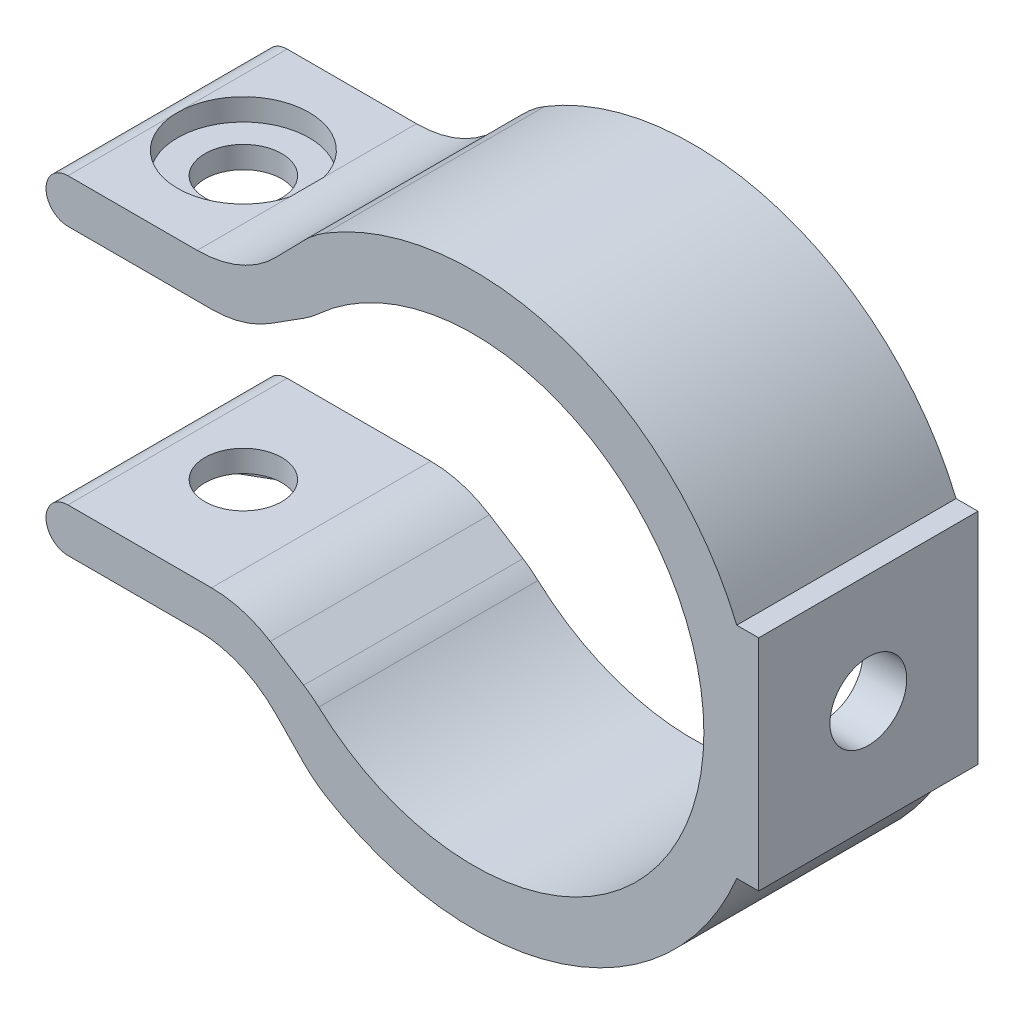
from build123d import *

# Parameters (mm, degrees)
EXTRUDE_1_DEPTH      = 5
EXTRUDE_1_DEPTH_BACK = 5
SKETCH_367_W         = 9
SKETCH_367_H         = 2
FILLET_1_R           = 5
FILLET_2_R           = 1
SKETCH_1_R           = 1.75
CUT_EXTRUDE_2_DEPTH  = 29.731515797
SKETCH_1_6_R         = 3
CUT_EXTRUDE_3_DEPTH  = 1
SKETCH_5_W           = 10
SKETCH_5_H           = 10
EXTRUDE_2_DEPTH      = 2
SKETCH_6_R           = 1.75
CUT_EXTRUDE_5_DEPTH  = 24.963513933
SKETCH_6_3_R         = 3
CUT_EXTRUDE_6_DEPTH  = 11
CUT_EXTRUDE_7_DEPTH  = 1


with BuildPart() as part:
    # Sketch 367 → Бобышка-Вытянуть1 (new, two sides: drawn at the far end of the back side and taken through both)
    with BuildSketch(Plane.XY.offset(-EXTRUDE_1_DEPTH_BACK)):
        with BuildLine():
            ThreePointArc((-7.348469228, 10.723805295), (13, 0), (-7.348469228, -10.723805295))
            Line((-7.348469228, -10.723805295), (-10.5, -7.5))
            Line((-10.5, -7.5), (-10.5, -5.5))
            Line((-10.5, -5.5), (-7.348469228, -7.5))
            ThreePointArc((-7.348469228, -7.5), (10.5, 0), (-7.348469228, 7.5))
            Line((-7.348469228, 7.5), (-10.5, 5.5))
            Line((-10.5, 5.5), (-10.5, 7.5))
            Line((-10.5, 7.5), (-7.348469228, 10.723805295))
        make_face()
        with Locations((-15, 6.5)):
            Rectangle(SKETCH_367_W, SKETCH_367_H)
        with Locations((-15, -6.5)):
            Rectangle(SKETCH_367_W, SKETCH_367_H)
    extrude(amount=EXTRUDE_1_DEPTH + EXTRUDE_1_DEPTH_BACK)

    # Скругление1
    fillet_1_edges = [part.edges().sort_by_distance(p)[0] for p in [
        (-7.348469228, -10.723805295, 0),
        (-10.5, -7.5, 0),
        (-10.5, -5.5, 0),
        (-7.348469228, -7.5, 0),
        (-7.348469228, 7.5, 0),
        (-10.5, 5.5, 0),
        (-10.5, 7.5, 0),
        (-7.348469228, 10.723805295, 0),
    ]]
    fillet(fillet_1_edges, radius=FILLET_1_R)

    # Скругление2
    fillet_2_edges = [part.edges().sort_by_distance(p)[0] for p in [
        (-19.5, -7.5, 0),
        (-19.5, -5.5, 0),
        (-19.5, 5.5, 0),
        (-19.5, 7.5, 0),
    ]]
    fillet(fillet_2_edges, radius=FILLET_2_R - 0.0001)  # a hair under: the kernel refuses the full size

    # Эскиз1 → Вырез-Вытянуть2 (cut, through all)
    with BuildSketch(Plane(origin=(0, 7.5, 0), x_dir=(1, 0, 0), z_dir=(0, 1, 0))):
        with Locations(Location((-15.5, 0, 0), (0, 0, 270))):
            Circle(SKETCH_1_R)
    extrude(amount=-CUT_EXTRUDE_2_DEPTH, mode=Mode.SUBTRACT)

    # Эскиз1<6> → Вырез-Вытянуть3 (cut)
    with BuildSketch(Plane(origin=(0, 7.5, 0), x_dir=(1, 0, 0), z_dir=(0, 1, 0))):
        with Locations(Location((-15.5, 0, 0), (0, 0, 270))):
            Circle(SKETCH_1_6_R)
    extrude(amount=-CUT_EXTRUDE_3_DEPTH, mode=Mode.SUBTRACT)

    # Эскиз5 → Бобышка-Вытянуть2 (add)
    with BuildSketch(Plane(origin=(13, 0, 0), x_dir=(0, 0, -1), z_dir=(1, 0, 0))):
        Rectangle(SKETCH_5_W, SKETCH_5_H)
    extrude(amount=-EXTRUDE_2_DEPTH)

    # Эскиз6 → Вырез-Вытянуть5 (cut, through all)
    with BuildSketch(Plane(origin=(0, 0, 0), x_dir=(0, 0, -1), z_dir=(1, 0, 0))):
        with Locations(Location((0, 0, 0), (0, 0, 180))):
            Circle(SKETCH_6_R)
    extrude(amount=CUT_EXTRUDE_5_DEPTH, mode=Mode.SUBTRACT)

    # Эскиз6<3> → Вырез-Вытянуть6 (cut)
    with BuildSketch(Plane(origin=(0, 0, 0), x_dir=(0, 0, -1), z_dir=(1, 0, 0))):
        with Locations(Location((0, 0, 0), (0, 0, 180))):
            Circle(SKETCH_6_3_R)
    extrude(amount=CUT_EXTRUDE_6_DEPTH, mode=Mode.SUBTRACT)

    # Эскиз8 → Вырез-Вытянуть7 (cut)
    with BuildSketch(Plane.XZ.offset(7.5)):
        Polygon((-15.5, 3.464101615), (-18.5, 1.732050808), (-18.5, -1.732050808), (-15.5, -3.464101615), (-12.5, -1.732050808), (-12.5, 1.732050808), align=None)
    extrude(amount=-CUT_EXTRUDE_7_DEPTH, mode=Mode.SUBTRACT)


solid = part.part
